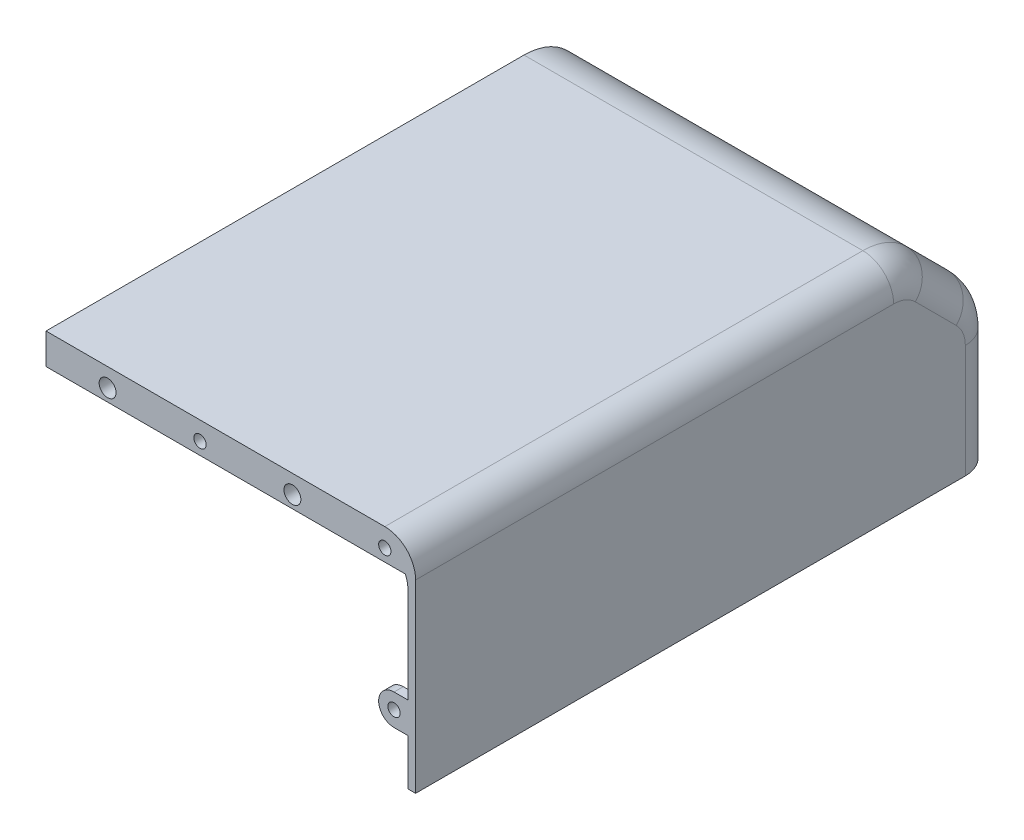
from build123d import *

# Parameters (mm, degrees)
CROQUIS1_R              = 13
SALIENTE_EXTRUIR1_DEPTH = 120
CORTAR_EXTRUIR1_DEPTH   = 117.5
REDONDEO1_R             = 20
CROQUIS3_W              = 250
CROQUIS3_H              = 250
CORTAR_EXTRUIR2_DEPTH   = 312.295872079
CORTAR_EXTRUIR4_DEPTH   = 5
CROQUIS7_R              = 2.75
CROQUIS7_R_2            = 2
CORTAR_EXTRUIR5_DEPTH   = 6
REDONDEO5_R             = 10
CROQUIS8_W              = 4
CROQUIS8_H              = 30
CORTAR_EXTRUIR6_DEPTH   = 15
REDONDEO6_R             = 2
CROQUIS9_R              = 2.25
SALIENTE_EXTRUIR3_DEPTH = 6
CROQUIS10_R             = 1.5
SALIENTE_EXTRUIR4_DEPTH = 3
CROQUIS11_R             = 2
SALIENTE_EXTRUIR5_DEPTH = 3


with BuildPart() as part:
    # Croquis1 → Saliente-Extruir1 (new body)
    with BuildSketch(Plane(origin=(0, 0, 0), x_dir=(0, 0, -1), z_dir=(1, 0, 0))):
        with BuildLine():
            Line((-210, 0), (210, 0))
            Line((210, 0), (210, 45))
            Line((210, 45), (185, 70))
            Line((185, 70), (21.52779525, 70))
            Line((21.52779525, 70), (21.52779525, 75))
            Line((21.52779525, 75), (-28.77527986, 148.293505427))
            ThreePointArc((-28.77527986, 148.293505427), (-68.645544514, 169.981651137), (-109.631887894, 150.484643051))
            Line((-109.631887894, 150.484643051), (-210, 20))
            Line((-210, 20), (-210, 0))
        make_face()
        with Locations((-70, 120)):
            Circle(CROQUIS1_R, mode=Mode.SUBTRACT)
    extrude(amount=-SALIENTE_EXTRUIR1_DEPTH)

    # Croquis2 → Cortar-Extruir1 (cut)
    with BuildSketch(Plane.ZY.offset(120)):
        with BuildLine():
            Line((106.461336862, 148.045871607), (206, 18.639562604))
            Line((206, 18.639562604), (206, 0))
            Line((206, 0), (-206, 0))
            Line((-206, 0), (-206, 43.343145751))
            Line((-206, 43.343145751), (-183.343145751, 66))
            Line((-183.343145751, 66), (-37.52779525, 66))
            Line((-37.52779525, 66), (-37.52779525, 60))
            Line((-37.52779525, 60), (-17.52779525, 60))
            Line((-17.52779525, 60), (-17.52779525, 73.759393051))
            Line((-17.52779525, 73.759393051), (32.073257471, 146.030024993))
            ThreePointArc((32.073257471, 146.030024993), (68.753900953, 165.983119046), (106.461336862, 148.045871607))
        make_face()
    extrude(amount=-CORTAR_EXTRUIR1_DEPTH, mode=Mode.SUBTRACT)

    # Redondeo1
    redondeo1_edges = [part.edges().sort_by_distance(p)[0] for p in [
        (-60, 20, 210),
        (-60, 70, -185),
        (-60, 45, -210),
        (-61.25, 66, -183.343145751),
        (-61.25, 43.343145751, -206),
        (-61.25, 18.639562604, 206),
    ]]
    fillet(redondeo1_edges, radius=REDONDEO1_R)

    # Croquis3 → Cortar-Extruir2 (cut, through all)
    with BuildSketch(Plane(origin=(0, 0, -21.52779525), x_dir=(-1, 0, 0), z_dir=(0, 0, -1))):
        with Locations((60, 70)):
            Rectangle(CROQUIS3_W, CROQUIS3_H)
    extrude(amount=-CORTAR_EXTRUIR2_DEPTH, mode=Mode.SUBTRACT)

    # Croquis6 → Cortar-Extruir4 (cut)
    with BuildSketch(Plane.ZY.offset(120)):
        with BuildLine():
            Line((-23.02779525, 61.5), (-23.02779525, 68.5))
            Line((-23.02779525, 68.5), (-176.715728753, 68.5))
            ThreePointArc((-176.715728753, 68.5), (-183.795372251, 67.091771351), (-189.797204204, 63.081475452))
            Line((-189.797204204, 63.081475452), (-203.081475452, 49.797204204))
            ThreePointArc((-203.081475452, 49.797204204), (-207.091771351, 43.795372251), (-208.5, 36.715728753))
            Line((-208.5, 36.715728753), (-208.5, 1.5))
            Line((-208.5, 1.5), (-207.5, 1.5))
            Line((-207.5, 1.5), (-207.5, 35.058874503))
            ThreePointArc((-207.5, 35.058874503), (-205.863409949, 43.286568299), (-201.202795796, 50.261670299))
            Line((-201.202795796, 50.261670299), (-190.261670299, 61.202795796))
            ThreePointArc((-190.261670299, 61.202795796), (-183.286568299, 65.863409949), (-175.058874503, 67.5))
            Line((-175.058874503, 67.5), (-36.02779525, 67.5))
            Line((-36.02779525, 67.5), (-36.02779525, 61.5))
            Line((-36.02779525, 61.5), (-23.02779525, 61.5))
        make_face()
    extrude(amount=-CORTAR_EXTRUIR4_DEPTH, mode=Mode.SUBTRACT)

    # Croquis7 → Cortar-Extruir5 (cut)
    with BuildSketch(Plane.XY.offset(-21.52779525)):
        with Locations((-40, 64)):
            Circle(CROQUIS7_R)
        with Locations((-100, 64)):
            Circle(CROQUIS7_R)
        with Locations((-70, 64)):
            Circle(CROQUIS7_R_2)
        with Locations((-10, 64)):
            Circle(CROQUIS7_R_2)
    extrude(amount=-CORTAR_EXTRUIR5_DEPTH, mode=Mode.SUBTRACT)

    # Redondeo5
    redondeo5_edges = [part.edges().sort_by_distance(p)[0] for p in [
        (0, 18.357864376, -210),
        (0, 44.3693974, -208.47759065),
        (0, 57.5, -197.5),
        (0, 68.47759065, -184.3693974),
        (0, 70, -99.121762001),
        (-2.5, 17.529437252, -206),
        (-2.5, 42.71254315, -204.47759065),
        (-2.5, 54.671572875, -194.671572875),
        (-2.5, 64.47759065, -182.71254315),
        (-2.5, 66, -106.293334877),
    ]]
    fillet(redondeo5_edges, radius=REDONDEO5_R)

    # Croquis8 → Cortar-Extruir6 (cut)
    with BuildSketch(Plane(origin=(0, 0, -210), x_dir=(-1, 0, 0), z_dir=(0, 0, -1))):
        with Locations((110, 18)):
            Rectangle(CROQUIS8_W, CROQUIS8_H)
        with Locations((100.9, 18)):
            Rectangle(CROQUIS8_W, CROQUIS8_H)
        with Locations((91.8, 18)):
            Rectangle(CROQUIS8_W, CROQUIS8_H)
        with Locations((82.7, 18)):
            Rectangle(CROQUIS8_W, CROQUIS8_H)
        with Locations((73.6, 18)):
            Rectangle(CROQUIS8_W, CROQUIS8_H)
        with Locations((64.5, 18)):
            Rectangle(CROQUIS8_W, CROQUIS8_H)
        with Locations((55.4, 18)):
            Rectangle(CROQUIS8_W, CROQUIS8_H)
        with Locations((46.3, 18)):
            Rectangle(CROQUIS8_W, CROQUIS8_H)
        with Locations((37.2, 18)):
            Rectangle(CROQUIS8_W, CROQUIS8_H)
        with Locations((28.1, 18)):
            Rectangle(CROQUIS8_W, CROQUIS8_H)
        with Locations((19, 18)):
            Rectangle(CROQUIS8_W, CROQUIS8_H)
    extrude(amount=-CORTAR_EXTRUIR6_DEPTH, mode=Mode.SUBTRACT)

    # Redondeo6
    redondeo6_edges = [part.edges().sort_by_distance(p)[0] for p in [
        (-21, 3, -208),
        (-17, 3, -208),
        (-17, 33, -208),
        (-30.1, 3, -208),
        (-26.1, 3, -208),
        (-26.1, 33, -208),
        (-30.1, 33, -208),
        (-39.2, 3, -208),
        (-35.2, 3, -208),
        (-35.2, 33, -208),
        (-39.2, 33, -208),
        (-48.3, 3, -208),
        (-44.3, 3, -208),
        (-44.3, 33, -208),
        (-48.3, 33, -208),
        (-57.4, 3, -208),
        (-53.4, 3, -208),
        (-53.4, 33, -208),
        (-57.4, 33, -208),
        (-66.5, 3, -208),
        (-62.5, 3, -208),
        (-62.5, 33, -208),
        (-66.5, 33, -208),
        (-75.6, 3, -208),
        (-71.6, 3, -208),
        (-71.6, 33, -208),
        (-75.6, 33, -208),
        (-84.7, 3, -208),
        (-80.7, 3, -208),
        (-80.7, 33, -208),
        (-84.7, 33, -208),
        (-93.8, 3, -208),
        (-89.8, 3, -208),
        (-89.8, 33, -208),
        (-93.8, 33, -208),
        (-102.9, 3, -208),
        (-98.9, 3, -208),
        (-98.9, 33, -208),
        (-102.9, 33, -208),
        (-112, 33, -208),
        (-112, 3, -208),
        (-108, 3, -208),
        (-108, 33, -208),
        (-21, 33, -208),
    ]]
    fillet(redondeo6_edges, radius=REDONDEO6_R - 0.0001)  # a hair under: the kernel refuses the full size

    # Croquis9 → Saliente-Extruir3 (add)
    with BuildSketch(Plane.XZ):
        with BuildLine():
            Line((-2.5, -125), (-5, -125))
            ThreePointArc((-5, -125), (-10, -130), (-5, -135))
            Line((-5, -135), (-2.5, -135))
            Line((-2.5, -135), (-2.5, -125))
        make_face()
        with Locations(Location((-5, -130, 0), (0, 0, 270))):
            Circle(CROQUIS9_R, mode=Mode.SUBTRACT)
    extrude(amount=-SALIENTE_EXTRUIR3_DEPTH)

    # Croquis10 → Saliente-Extruir4 (add)
    with BuildSketch(Plane.ZY.offset(120)):
        with BuildLine():
            Line((-210, 0), (-216, 0))
            ThreePointArc((-216, 0), (-221, 5), (-216, 10))
            Line((-216, 10), (-210, 10))
            Line((-210, 10), (-210, 0))
        make_face()
        with Locations((-216, 5)):
            Circle(CROQUIS10_R, mode=Mode.SUBTRACT)
    extrude(amount=-SALIENTE_EXTRUIR4_DEPTH)

    # Croquis11 → Saliente-Extruir5 (add)
    with BuildSketch(Plane.XY.offset(-21.52779525)):
        with BuildLine():
            Line((-2.5, 15), (-7, 15))
            ThreePointArc((-7, 15), (-12, 20), (-7, 25))
            Line((-7, 25), (-2.5, 25))
            Line((-2.5, 25), (-2.5, 15))
        make_face()
        with Locations((-7, 20)):
            Circle(CROQUIS11_R, mode=Mode.SUBTRACT)
    extrude(amount=-SALIENTE_EXTRUIR5_DEPTH)


solid = part.part
